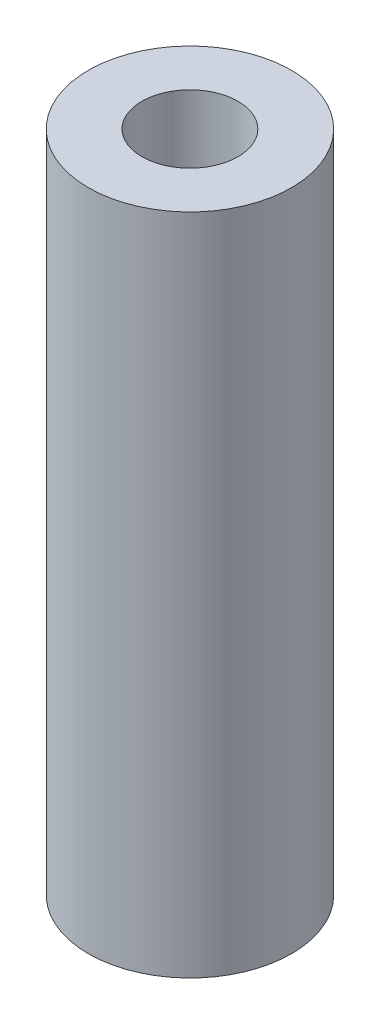
from build123d import *

# Parameters (mm, degrees)
SKETCH1_R           = 5.975
BOSS_EXTRUDE1_DEPTH = 39
SKETCH2_R           = 2.825
CUT_EXTRUDE1_DEPTH  = 4.5


with BuildPart() as part:
    # Sketch1 → Boss-Extrude1 (new body)
    with BuildSketch(Plane(origin=(0, 0, 0), x_dir=(1, 0, 0), z_dir=(0, 1, 0))):
        Circle(SKETCH1_R)
    extrude(amount=BOSS_EXTRUDE1_DEPTH)

    # Sketch2 → Cut-Extrude1 (cut)
    with BuildSketch(Plane(origin=(0, 39, 0), x_dir=(1, 0, 0), z_dir=(0, 1, 0))):
        Circle(SKETCH2_R)
    extrude(amount=-CUT_EXTRUDE1_DEPTH, mode=Mode.SUBTRACT)


solid = part.part
